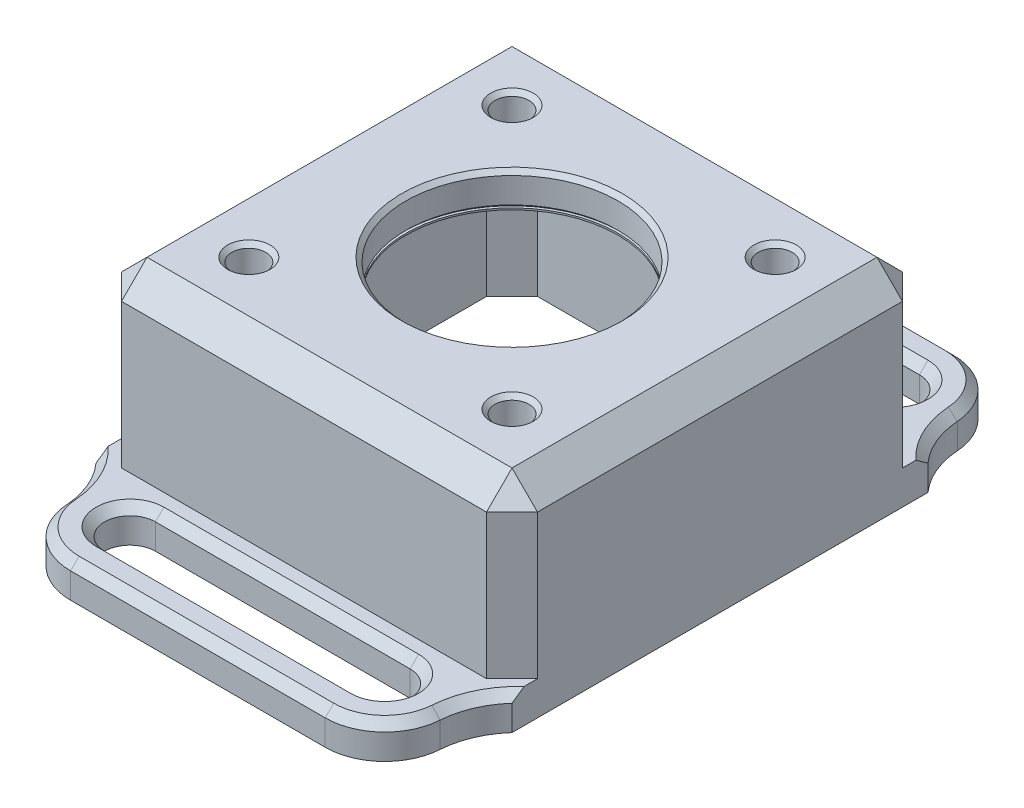
from build123d import *

# Parameters (mm, degrees)
SKETCH1_W             = 43
SKETCH1_H             = 43
BOSS_EXTRUDE1_DEPTH   = 4
SKETCH2_W             = 49
SKETCH2_H             = 49
SKETCH2_W_2           = 43
SKETCH2_H_2           = 43
BOSS_EXTRUDE2_DEPTH   = 16
FILLET1_R             = 10
SKETCH3_W             = 49
SKETCH3_H             = 49
SKETCH3_R             = 12.5
BOSS_EXTRUDE3_DEPTH   = 4
F_4_0MM_DOWEL_HOLE1_D = 4
CHAMFER1_SIZE         = 3
CHAMFER3_SIZE         = 0.5
CHAMFER4_SIZE         = 1
SKETCH8_W             = 38.715759924
SKETCH8_H             = 37.056710796
BOSS_EXTRUDE4_DEPTH   = 0.2
SKETCH9_R             = 12.5
CUT_EXTRUDE2_DEPTH    = 49.757460968
SKETCH10_R            = 2
CUT_EXTRUDE3_DEPTH    = 49.757460968


with BuildPart() as part:
    # Sketch1 → Boss-Extrude1 (new body)
    with BuildSketch(Plane(origin=(0, 0, 0), x_dir=(1, 0, 0), z_dir=(0, 1, 0))):
        with BuildLine():
            Line((-24.5, 24.5), (-19.330127019, 24.5))
            ThreePointArc((-19.330127019, 24.5), (-21.614378278, 32.291287847), (-15, 37))
            Line((-15, 37), (15, 37))
            ThreePointArc((15, 37), (21.614378278, 32.291287847), (19.330127019, 24.5))
            Line((19.330127019, 24.5), (24.5, 24.5))
            Line((24.5, 24.5), (24.5, 6.437196595))
            Line((24.5, 6.437196595), (24.5, -24.5))
            Line((24.5, -24.5), (19.330127019, -24.5))
            ThreePointArc((19.330127019, -24.5), (21.614378278, -32.291287847), (15, -37))
            Line((15, -37), (-15, -37))
            ThreePointArc((-15, -37), (-21.614378278, -32.291287847), (-19.330127019, -24.5))
            Line((-19.330127019, -24.5), (-24.5, -24.5))
            Line((-24.5, -24.5), (-24.5, 6.437196595))
            Line((-24.5, 6.437196595), (-24.5, 24.5))
        make_face()
        Rectangle(SKETCH1_W, SKETCH1_H, mode=Mode.SUBTRACT)
        with BuildLine():
            Line((15, 27), (-15, 27))
            ThreePointArc((-15, 27), (-18, 30), (-15, 33))
            Line((-15, 33), (15, 33))
            ThreePointArc((15, 33), (18, 30), (15, 27))
        make_face(mode=Mode.SUBTRACT)
        with BuildLine():
            Line((-15, -27), (15, -27))
            ThreePointArc((15, -27), (18, -30), (15, -33))
            Line((15, -33), (-15, -33))
            ThreePointArc((-15, -33), (-18, -30), (-15, -27))
        make_face(mode=Mode.SUBTRACT)
    extrude(amount=BOSS_EXTRUDE1_DEPTH)

    # Sketch2 → Boss-Extrude2 (add)
    with BuildSketch(Plane(origin=(0, 4, 0), x_dir=(1, 0, 0), z_dir=(0, 1, 0))):
        Rectangle(SKETCH2_W, SKETCH2_H)
        Rectangle(SKETCH2_W_2, SKETCH2_H_2, mode=Mode.SUBTRACT)
    extrude(amount=BOSS_EXTRUDE2_DEPTH)

    # Fillet1
    # the kernel refuses this fillet: 10 mm, written as the material it adds along each edge
    with BuildSketch(Plane(origin=(19.330127019, 0, 24.5), x_dir=(0.405761244184207, 0, 0.913979109563279), z_dir=(0, 1, 0))) as fillet1_piece_1:
        with BuildLine():
            CenterArc((11.211042432, 8.841903543), FILLET1_R, 204.310084353, 37.841965765)
            Line((2.097734093, 4.725155904), (1.915467926, 4.642820951))
            ThreePointArc((1.915467926, 4.642820951), (0.866071225, 2.443730201), (-0.182795822, 0.081152249))
            Line((-0.182795822, 0.081152249), (0.093425354, -0.176838071))
            ThreePointArc((0.093425354, -0.176838071), (3.269887376, 0.61066752), (6.446349398, -0.176838071))
            Line((6.446349398, -0.176838071), (6.539774752, 0))
        make_face()
    extrude(amount=4)
    with BuildSketch(Plane(origin=(19.330127019, 0, -24.5), x_dir=(1, 0, 0), z_dir=(0, 1, 0))) as fillet1_piece_2:
        with BuildLine():
            CenterArc((12.630321653, 6.658956796), FILLET1_R, 183.909110465, 37.841965765)
            Line((2.65358714, 5.977217504), (2.45405245, 5.963582719))
            ThreePointArc((2.45405245, 5.963582719), (1.884930926, 2.74082354), (-0.123717915, 0.157142857))
            Line((-0.123717915, 0.157142857), (0, -0.2))
            ThreePointArc((0, -0.2), (2.584936491, -0.2), (5.020664008, -0.133179136))
            Line((5.020664008, -0.133179136), (5.169872981, 0))
        make_face()
    extrude(amount=4)
    with BuildSketch(Plane(origin=(-19.330127019, 0, -24.5), x_dir=(-1, 0, 0), z_dir=(0, 1, 0))) as fillet1_piece_3:
        with BuildLine():
            CenterArc((12.630321653, -6.658956796), FILLET1_R, 138.24892377, 37.841965765)
            Line((2.65358714, -5.977217504), (2.45405245, -5.963582719))
            ThreePointArc((2.45405245, -5.963582719), (1.884930926, -2.74082354), (-0.123717915, -0.157142857))
            Line((-0.123717915, -0.157142857), (0, 0.2))
            ThreePointArc((0, 0.2), (2.584936491, 0.2), (5.020664008, 0.133179136))
            Line((5.020664008, 0.133179136), (5.169872981, 0))
        make_face()
    extrude(amount=4)
    with BuildSketch(Plane(origin=(-19.330127019, 0, 24.5), x_dir=(-0.40576124418420745, 0, 0.9139791095632787), z_dir=(0, 1, 0))) as fillet1_piece_4:
        with BuildLine():
            CenterArc((11.211042432, -8.841903543), FILLET1_R, 117.847949882, 37.841965765)
            Line((2.097734093, -4.725155904), (1.915467926, -4.642820951))
            ThreePointArc((1.915467926, -4.642820951), (0.866071225, -2.443730201), (-0.182795822, -0.081152249))
            Line((-0.182795822, -0.081152249), (0.093425354, 0.176838071))
            ThreePointArc((0.093425354, 0.176838071), (3.269887376, -0.61066752), (6.446349398, 0.176838071))
            Line((6.446349398, 0.176838071), (6.539774752, 0))
        make_face()
    extrude(amount=4)

    # Sketch3 → Boss-Extrude3 (add)
    with BuildSketch(Plane(origin=(0, 20, 0), x_dir=(1, 0, 0), z_dir=(0, 1, 0))):
        Rectangle(SKETCH3_W, SKETCH3_H)
        with Locations(Location((0, 0, 0), (0, 0, 270))):
            Circle(SKETCH3_R, mode=Mode.SUBTRACT)
    extrude(amount=BOSS_EXTRUDE3_DEPTH)

    # Ø4.0mm Dowel Hole1 (through all)
    with Locations(Plane(origin=(0, 24, 0), x_dir=(1, 0, 0), z_dir=(0, 1, 0))):
        with Locations((15.5, 15.5), (-15.5, 15.5), (-15.5, -15.5), (15.5, -15.5)):
            Hole(F_4_0MM_DOWEL_HOLE1_D / 2)

    # Chamfer1
    chamfer1_edges = [part.edges().sort_by_distance(p)[0] for p in [
        (24.5, 24, 0),
        (0, 24, -24.5),
        (-24.5, 24, 0),
        (0, 24, 24.5),
        (-24.5, 14, 24.5),
        (-24.5, 14, -24.5),
        (24.5, 14, -24.5),
        (24.5, 14, 24.5),
        (-21.5, 10, -21.5),
        (-21.5, 10, 21.5),
        (21.5, 10, 21.5),
        (21.5, 10, -21.5),
    ]]
    chamfer(chamfer1_edges, length=CHAMFER1_SIZE)

    # Chamfer3
    chamfer3_edges = [part.edges().sort_by_distance(p)[0] for p in [
        (0, 20, -12.5),
        (0, 24, -12.5),
        (17.5, 24, 15.5),
        (-13.5, 24, 15.5),
        (-13.5, 24, -15.5),
        (17.5, 24, -15.5),
    ]]
    chamfer(chamfer3_edges, length=CHAMFER3_SIZE)

    # Chamfer4
    chamfer4_edges = [part.edges().sort_by_distance(p)[0] for p in [
        (-19.778047586, 4, 35.115687761),
        (19.778047586, 4, -35.115687761),
        (0, 4, -37),
        (-22.743853768, 4, 27.278959583),
        (22.743853768, 4, 27.278959583),
        (22.743853768, 4, -27.278959583),
        (-22.743853768, 4, -27.278959583),
        (-19.778047586, 4, -35.115687761),
        (18, 4, 30),
        (0, 4, 33),
        (-18, 4, 30),
        (18, 4, -30),
        (0, 4, -27),
        (-18, 4, -30),
        (0, 4, -33),
        (0, 4, 37),
        (19.778047586, 4, 35.115687761),
        (0, 4, 27),
    ]]
    chamfer(chamfer4_edges, length=CHAMFER4_SIZE)

    # Sketch8 → Boss-Extrude4 (add)
    with BuildSketch(Plane.XZ.offset(-20)):
        Rectangle(SKETCH8_W, SKETCH8_H)
    extrude(amount=-BOSS_EXTRUDE4_DEPTH)

    # Sketch9 → Cut-Extrude2 (cut, through all)
    with BuildSketch(Plane(origin=(0, 20.2, 0), x_dir=(1, 0, 0), z_dir=(0, 1, 0))):
        with Locations(Location((0, 0, 0), (0, 0, 90))):
            Circle(SKETCH9_R)
    extrude(amount=-CUT_EXTRUDE2_DEPTH, mode=Mode.SUBTRACT)

    # Sketch10 → Cut-Extrude3 (cut, through all)
    with BuildSketch(Plane(origin=(0, 20.2, 0), x_dir=(1, 0, 0), z_dir=(0, 1, 0))):
        with Locations(Location((-15.5, 15.5, 0), (0, 0, 90))):
            Circle(SKETCH10_R)
        with Locations(Location((-15.5, -15.5, 0), (0, 0, 90))):
            Circle(SKETCH10_R)
        with Locations(Location((15.5, -15.5, 0), (0, 0, 90))):
            Circle(SKETCH10_R)
        with Locations(Location((15.5, 15.5, 0), (0, 0, 90))):
            Circle(SKETCH10_R)
    extrude(amount=-CUT_EXTRUDE3_DEPTH, mode=Mode.SUBTRACT)


solid = part.part
